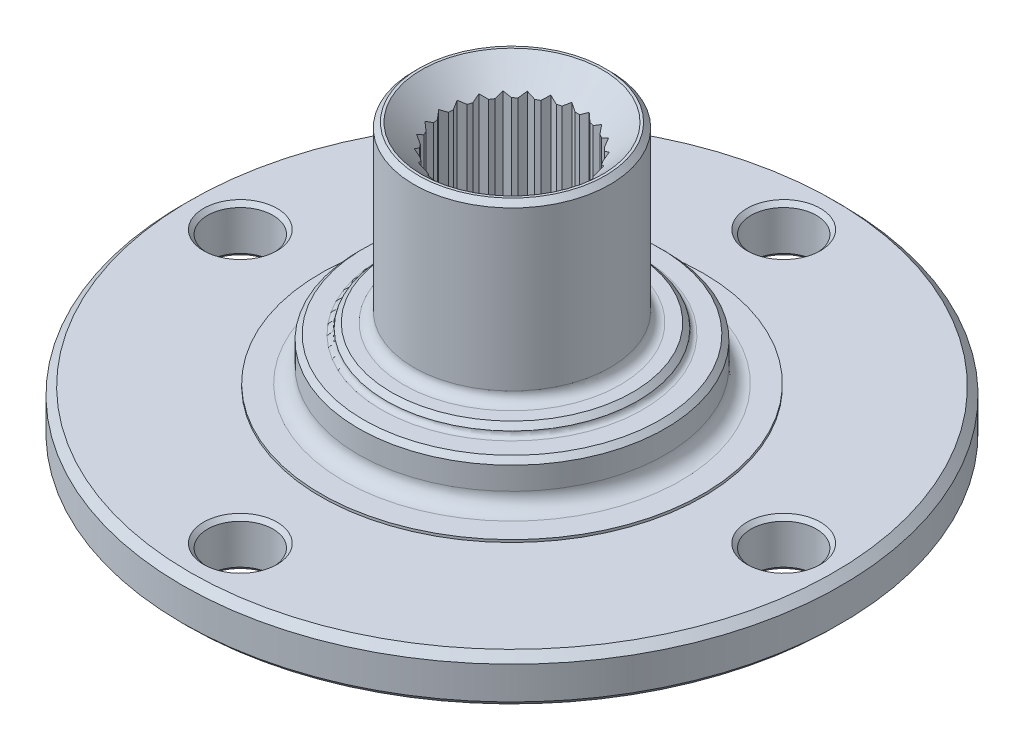
from build123d import *
from OCP.BRepFilletAPI import BRepFilletAPI_MakeChamfer

# Parameters (mm, degrees)
CHANFRO1_SIZE         = 5
CORTE_EXTRUS_O1_DEPTH = 116.674732604
CHANFRO2_SIZE         = 1
FILETE1_R             = 2
FILETE2_R             = 1
FILETE3_R             = 3
CHANFRO3_SIZE         = 1.5
FILETE4_R             = 2
FILETE5_R             = 1
CHANFRO4_SIZE         = 1
CHANFRO5_SIZE         = 0.5
CHANFRO5_SIZE2        = 0.181985117
CHANFRO5_SIZE2_2      = 0.404644302
ESBO_O3_R             = 6.5
CORTE_EXTRUS_O2_DEPTH = 10
CHANFRO6_SIZE         = 0.8


with BuildPart() as part:
    # Esboço1 → Revolução1 (revolve)
    with BuildSketch(Plane.XY, mode=Mode.PRIVATE) as revolu_o1_sk:
        Polygon((30.799373455, 33.665399276), (24.299373455, 33.665399276), (24.299373455, -22.834600724), (39.299373455, -22.834600724), (39.299373455, -40.834600724), (42.799373455, -40.834600724), (42.799373455, -27.834600724), (42.949373455, -27.834600724), (42.949373455, -21.334600724), (76.799373455, -21.334600724), (76.799373455, -11.834600724), (49.299373455, -11.834600724), (49.299373455, -11.334600724), (41.799373455, -11.334600724), (41.799373455, -2.834600724), (36.299373455, -2.834600724), (36.299373455, -0.834600724), (30.799373455, -0.834600724), align=None)
    revolve(revolu_o1_sk.sketch.rotate(Axis((11.299373455, -35.954010887, 0), (0, 1, 0)), 90), axis=Axis((11.299373455, -35.954010887, 0), (0, 1, 0)))

    # Chanfro1
    chanfro1_edges = [part.edges().sort_by_distance(p)[0] for p in [
        (11.299373455, 33.665399276, 13),
    ]]
    chamfer(chanfro1_edges, length=CHANFRO1_SIZE)

    # Esboço2 → Corte-extrusão1 (cut, through all)
    with BuildSketch(Plane.XZ.offset(22.834600724)):
        Polygon((11.299373455, 13.733489047), (9.799373455, 12.733489047), (12.799373455, 12.733489047), align=None)
        Polygon((14.714753296, 13.302026235), (13.013188667, 12.706477904), (15.918938151, 11.960408243), align=None)
        Polygon((17.915532261, 12.034748193), (16.119318567, 11.881072024), (18.748238607, 10.435811001), align=None)
        Polygon((20.700593636, 10.011282661), (18.922593589, 10.309134692), (21.109499471, 8.255493374), align=None)
        Polygon((22.894941772, 7.35877142), (21.246873654, 8.089436513), (22.854354039, 5.556452737), align=None)
        Polygon((24.360697705, 4.243881508), (22.946115697, 5.361449288), (23.87316668, 2.508279739), align=None)
        Polygon((25.005762598, 0.862332912), (23.913550091, 2.296582485), (24.101921649, -0.6974977), align=None)
        Polygon((24.789604654, -2.573399232), (24.088389375, -0.912587041), (23.526245431, -3.859448793), align=None)
        Polygon((23.725805869, -5.847435237), (23.459647754, -4.064415367), (22.18230988, -6.778896524), align=None)
        Polygon((21.881208635, -8.754055382), (22.066831377, -6.960861528), (20.154559408, -9.272401256), align=None)
        Polygon((19.371715779, -11.110626031), (19.997456018, -9.419931159), (17.570405035, -11.183286915), align=None)
        Polygon((16.355007967, -12.769075185), (17.381548143, -11.287111871), (14.592218685, -12.391485529), align=None)
        Polygon((13.020636045, -13.625196384), (14.383474863, -12.445081833), (11.407130759, -12.821081533), align=None)
        Polygon((9.578110864, -13.625196384), (11.19161615, -12.821081533), (8.215272046, -12.445081833), align=None)
        Polygon((6.243738942, -12.769075185), (8.006528224, -12.391485529), (5.217198766, -11.287111871), align=None)
        Polygon((3.22703113, -11.110626031), (5.028341874, -11.183286915), (2.601290891, -9.419931159), align=None)
        Polygon((0.717538274, -8.754055382), (2.444187501, -9.272401256), (0.531915532, -6.960861528), align=None)
        Polygon((-1.12705896, -5.847435237), (0.41643703, -6.778896524), (-0.860900845, -4.064415367), align=None)
        Polygon((-2.190857745, -2.573399232), (-0.927498522, -3.859448793), (-1.489642466, -0.912587041), align=None)
        Polygon((-2.407015689, 0.862332912), (-1.50317474, -0.6974977), (-1.314803182, 2.296582485), align=None)
        Polygon((-1.761950795, 4.243881508), (-1.274419771, 2.508279739), (-0.347368788, 5.361449288), align=None)
        Polygon((-0.296194863, 7.35877142), (-0.25560713, 5.556452737), (1.351873255, 8.089436513), align=None)
        Polygon((1.898153273, 10.011282661), (1.489247438, 8.255493374), (3.67615332, 10.309134692), align=None)
        Polygon((4.683214648, 12.034748193), (3.850508302, 10.435811001), (6.479428342, 11.881072024), align=None)
        Polygon((7.883993613, 13.302026235), (6.679808758, 11.960408243), (9.585558242, 12.706477904), align=None)
    extrude(amount=-CORTE_EXTRUS_O1_DEPTH, mode=Mode.SUBTRACT)

    # Chanfro2
    chanfro2_edges = [part.edges().sort_by_distance(p)[0] for p in [
        (11.299373455, -0.834600724, 25),
        (11.299373455, -2.834600724, 30.5),
        (11.299373455, 33.665399276, 19.5),
    ]]
    chamfer(chanfro2_edges, length=CHANFRO2_SIZE)

    # Filete1
    filete1_edges = [part.edges().sort_by_distance(p)[0] for p in [
        (11.299373455, -0.834600724, 19.5),
    ]]
    fillet(filete1_edges, radius=FILETE1_R)

    # Filete2
    filete2_edges = [part.edges().sort_by_distance(p)[0] for p in [
        (11.299373455, -2.834600724, 25),
    ]]
    fillet(filete2_edges, radius=FILETE2_R - 0.0001)  # a hair under: the kernel refuses the full size

    # Filete3
    filete3_edges = [part.edges().sort_by_distance(p)[0] for p in [
        (11.299373455, -11.334600724, 30.5),
    ]]
    fillet(filete3_edges, radius=FILETE3_R)

    # Chanfro3
    chanfro3_edges = [part.edges().sort_by_distance(p)[0] for p in [
        (11.299373455, -11.834600724, 65.5),
        (11.299373455, -21.334600724, 65.5),
    ]]
    chamfer(chanfro3_edges, length=CHANFRO3_SIZE)

    # Filete4
    filete4_edges = [part.edges().sort_by_distance(p)[0] for p in [
        (11.299373455, -21.334600724, 31.65),
    ]]
    fillet(filete4_edges, radius=FILETE4_R)

    # Filete5
    filete5_edges = [part.edges().sort_by_distance(p)[0] for p in [
        (11.299373455, -22.834600724, 28),
    ]]
    fillet(filete5_edges, radius=FILETE5_R)

    # Chanfro4
    chanfro4_edges = [part.edges().sort_by_distance(p)[0] for p in [
        (11.299373455, -40.834600724, 31.5),
        (11.299373455, -40.834600724, 28),
    ]]
    chamfer(chanfro4_edges, length=CHANFRO4_SIZE)

    # Chanfro5: one chamfer whose edges measure the first distance from different faces: ONE call of the kernel's chamfer builder (chamfer() names one face for all edges)
    chanfro5_edges_1 = [part.edges().sort_by_distance(p)[0] for p in [
        (21.316045611, -22.834600724, 8.286511867),
        (23.062125137, -22.834600724, 5.53513079),
        (24.069107714, -22.834600724, 2.43595709),
        (24.273720924, -22.834600724, -0.816276754),
        (23.663108166, -22.834600724, -4.017220927),
        (22.275636486, -22.834600724, -6.965748335),
        (20.198485832, -22.834600724, -9.476592156),
        (17.562171218, -22.834600724, -11.391986841),
        (14.532341988, -22.834600724, -12.591581095),
        (11.299373455, -22.834600724, -13),
        (8.066404921, -22.834600724, -12.591581095),
        (5.036575691, -22.834600724, -11.391986841),
        (2.400261077, -22.834600724, -9.476592156),
        (0.323110423, -22.834600724, -6.965748335),
        (-1.064361257, -22.834600724, -4.017220927),
        (-1.674974015, -22.834600724, -0.816276754),
        (-1.470360805, -22.834600724, 2.43595709),
        (-0.463378227, -22.834600724, 5.53513079),
        (1.282701298, -22.834600724, 8.286511867),
        (6.51375427, -22.834600724, 12.087094317),
        (9.670041418, -22.834600724, 12.897491117),
        (12.928705491, -22.834600724, 12.897491117),
        (16.084992639, -22.834600724, 12.087094317),
        (18.940581734, -22.834600724, 10.517220927),
    ]]
    chanfro5_side_1 = [part.faces().sort_by_distance(p)[0] for p in [
        (11.299373455, -22.834600724, 26.236324676),
    ]]
    chanfro5_edges_2 = [part.edges().sort_by_distance(p)[0] for p in [
        (11.299373455, -21.334600724, 64),
    ]]
    chanfro5_side_2 = [part.faces().sort_by_distance(p)[0] for p in [
        (11.299373455, -20.584600724, 64.75),
    ]]
    chanfro5 = BRepFilletAPI_MakeChamfer(part.part.solid().wrapped)
    for e in chanfro5_edges_1:
        chanfro5.Add(CHANFRO5_SIZE, CHANFRO5_SIZE2, e.wrapped, chanfro5_side_1[0].wrapped)  # the first distance lies on this face
    for e in chanfro5_edges_2:
        chanfro5.Add(CHANFRO5_SIZE, CHANFRO5_SIZE2_2, e.wrapped, chanfro5_side_2[0].wrapped)  # the first distance lies on this face
    add(Compound.cast(chanfro5.Shape()), mode=Mode.REPLACE)

    # Esboço3 → Corte-extrusão2 (cut)
    with BuildSketch(Plane.XZ.offset(21.334600724)):
        with Locations(Location((-42.700626545, 0, 0), (0, 0, 270))):
            Circle(ESBO_O3_R)
        with Locations(Location((11.299373455, 54, 0), (0, 0, 270))):
            Circle(ESBO_O3_R)
        with Locations(Location((65.299373455, 0, 0), (0, 0, 270))):
            Circle(ESBO_O3_R)
        with Locations(Location((11.299373455, -54, 0), (0, 0, 270))):
            Circle(ESBO_O3_R)
    extrude(amount=-CORTE_EXTRUS_O2_DEPTH, mode=Mode.SUBTRACT)

    # Chanfro6
    chanfro6_edges = [part.edges().sort_by_distance(p)[0] for p in [
        (-42.700626545, -11.834600724, 6.5),
        (-42.700626545, -21.334600724, 6.5),
        (11.299373455, -11.834600724, 60.5),
        (11.299373455, -21.334600724, 60.5),
        (65.299373455, -11.834600724, 6.5),
        (65.299373455, -21.334600724, 6.5),
        (11.299373455, -11.834600724, -47.5),
        (11.299373455, -21.334600724, -47.5),
    ]]
    chamfer(chanfro6_edges, length=CHANFRO6_SIZE)


solid = part.part
